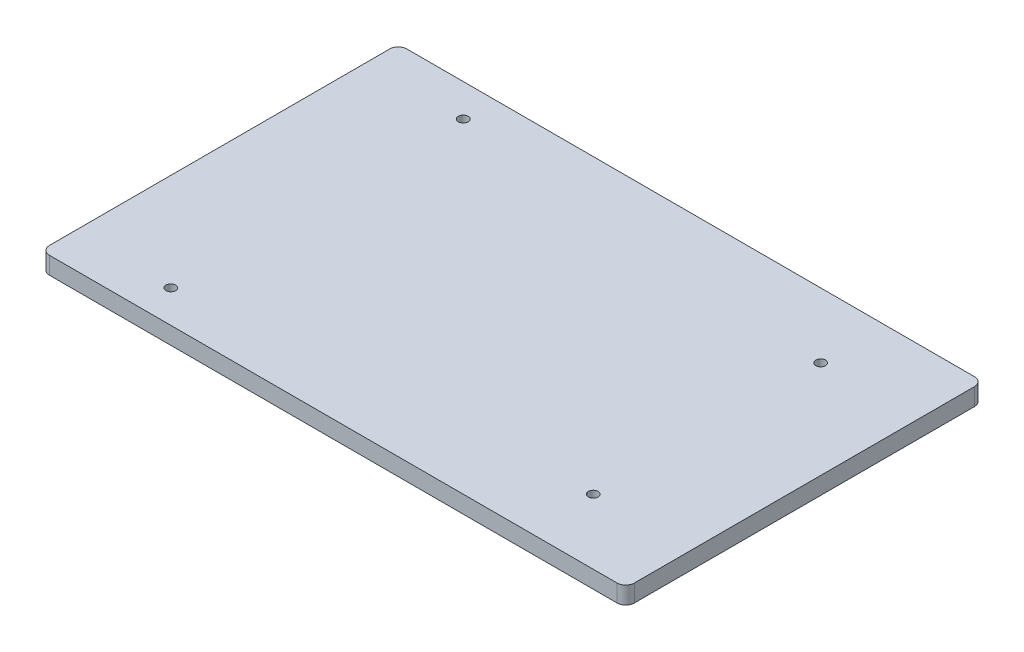
from build123d import *

# Parameters (mm, degrees)
CROQUIS1_W              = 270
CROQUIS1_H              = 165
SALIENTE_EXTRUIR1_DEPTH = 8
REDONDEO1_R             = 4
CROQUIS2_R              = 2.25
CORTAR_EXTRUIR1_DEPTH   = 159.414803601
CROQUIS3_R              = 2.25
CORTAR_EXTRUIR2_DEPTH   = 159.414803601


with BuildPart() as part:
    # Croquis1 → Saliente-Extruir1 (new body)
    with BuildSketch(Plane(origin=(0, 0, 0), x_dir=(1, 0, 0), z_dir=(0, 1, 0))):
        Rectangle(CROQUIS1_W, CROQUIS1_H)
    extrude(amount=SALIENTE_EXTRUIR1_DEPTH)

    # Redondeo1
    redondeo1_edges = [part.edges().sort_by_distance(p)[0] for p in [
        (-135, 4, -82.5),
        (135, 4, -82.5),
        (135, 4, 82.5),
        (-135, 4, 82.5),
    ]]
    fillet(redondeo1_edges, radius=REDONDEO1_R)

    # Croquis2 → Cortar-Extruir1 (cut, through all)
    with BuildSketch(Plane(origin=(0, 8, 0), x_dir=(1, 0, 0), z_dir=(0, 1, 0))):
        with Locations((90, 52.5)):
            Circle(CROQUIS2_R)
    cortar_extruir1 = extrude(amount=-CORTAR_EXTRUIR1_DEPTH, mode=Mode.SUBTRACT)

    # Simetría1: Cortar-Extruir1 across plane
    add(cortar_extruir1.mirror(Plane.XY), mode=Mode.SUBTRACT)

    # Croquis3 → Cortar-Extruir2 (cut, through all)
    with BuildSketch(Plane(origin=(0, 8, 0), x_dir=(1, 0, 0), z_dir=(0, 1, 0))):
        with Locations((-90, 67.5)):
            Circle(CROQUIS3_R)
        with Locations((-90, -67.5)):
            Circle(CROQUIS3_R)
    extrude(amount=-CORTAR_EXTRUIR2_DEPTH, mode=Mode.SUBTRACT)


solid = part.part
